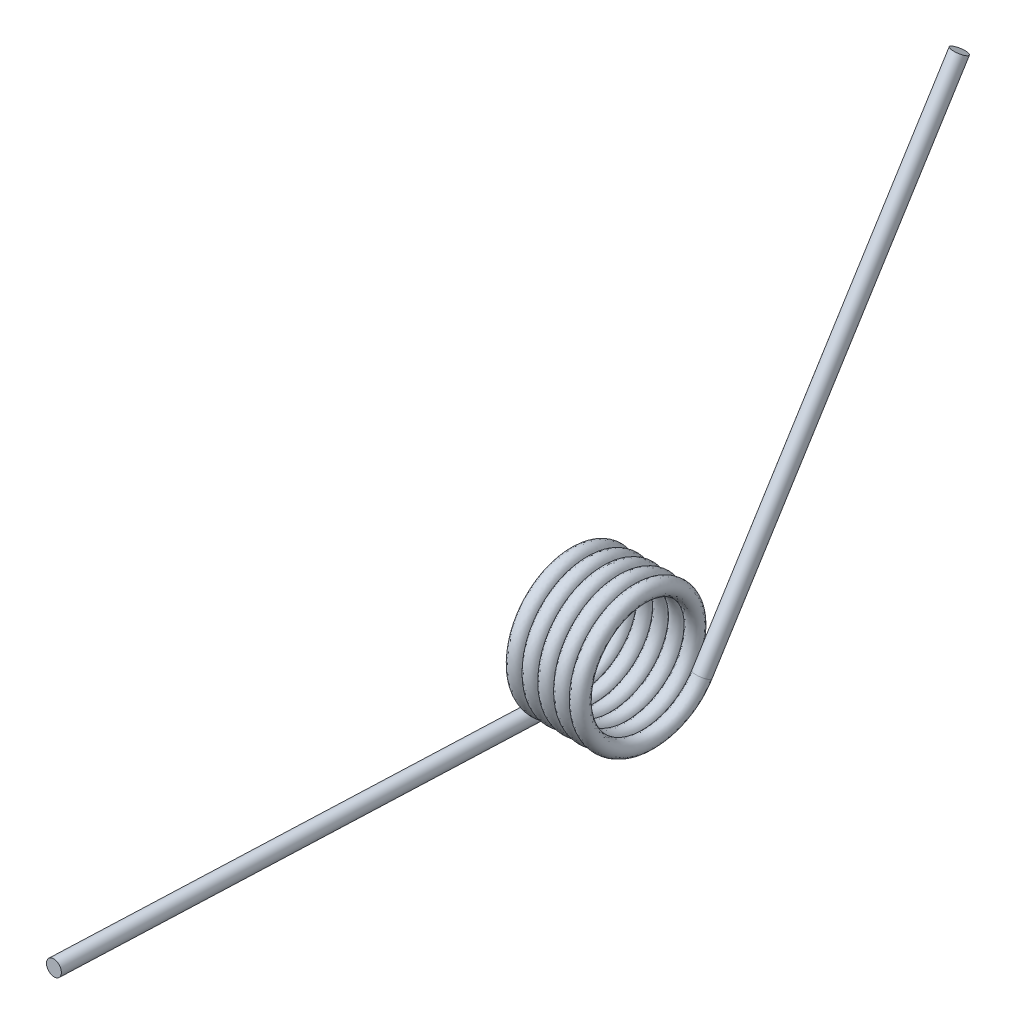
from build123d import *

# Parameters (mm, degrees)
SWEEP1_PITCH   = 1.6256
SKETCH3_R      = 0.8001
EXTRUDE1_DEPTH = 50.8
SKETCH4_R      = 0.8001
EXTRUDE2_DEPTH = 50.8


with BuildPart() as part:
    # Sweep1: the profile of Sketch2 screwed along a right-hand helix of 5.17 turns, 6 arcs to a turn; built about Z, then put on its axis
    sweep1_z = Axis((0, 0, 0), (0, 0, 1))
    sweep1_corners = [(6.240771643, -0.032638523, 0.796263457), (7.108832097, -0.002913077, 0.071068679), (6.383028357, 0.032638523, -0.796263457), (5.514967903, 0.002913077, -0.071068679)]
    with BuildLine(mode=Mode.PRIVATE) as sweep1_profile:
        ThreePointArc((6.240771643, -0.032638523, 0.796263457), (6.825120746, -0.025138777, 0.613296435), (7.108832097, -0.002913077, 0.071068679))
        ThreePointArc((7.108832097, -0.002913077, 0.071068679), (6.925711433, 0.021019065, -0.512790146), (6.383028357, 0.032638523, -0.796263457))
        ThreePointArc((6.383028357, 0.032638523, -0.796263457), (5.798679254, 0.025138777, -0.613296435), (5.514967903, 0.002913077, -0.071068679))
        ThreePointArc((5.514967903, 0.002913077, -0.071068679), (5.698088567, -0.021019065, 0.512790146), (6.240771643, -0.032638523, 0.796263457))
    sweep1_cap = Face(sweep1_profile.wire())
    sweep1_arcs = [((6.240771643, -0.032638523, 0.796263457), (7.03770374, -0.0355516, 0.867332136), (7.108832097, -0.002913077, 0.071068679), (1, 0.7071067811865476, 1)), ((7.108832097, -0.002913077, 0.071068679), (7.179960453, 0.029725446, -0.725194779), (6.383028357, 0.032638523, -0.796263457), (1, 0.7071067811865476, 1)), ((6.383028357, 0.032638523, -0.796263457), (5.58609626, 0.0355516, -0.867332136), (5.514967903, 0.002913077, -0.071068679), (1, 0.7071067811865476, 1)), ((5.514967903, 0.002913077, -0.071068679), (5.443839547, -0.029725446, 0.725194779), (6.240771643, -0.032638523, 0.796263457), (1, 0.7071067811865476, 1))]  # start, shoulder, end, weights
    sweep1_turn_angles = [0, 30, 60, 90, 120, 150, 180, 210, 240, 270, 300, 330, 360]
    sweep1_turn_weights = [1, 0.8660254037844387, 1, 0.8660254037844387, 1, 0.8660254037844387, 1, 0.8660254037844387, 1, 0.8660254037844387, 1, 0.8660254037844387, 1]
    sweep1_turn_sides = [Face.make_bezier_surface([[Vector(p[j][0], p[j][1], 0).rotate(sweep1_z, sweep1_turn_angles[2 * i + k]) / sweep1_turn_weights[2 * i + k] + Vector(0, 0, p[j][2] + SWEEP1_PITCH * sweep1_turn_angles[2 * i + k] / 360) for k in range(3)] for j in range(3)], [[p[3][j] * sweep1_turn_weights[2 * i + k] for k in range(3)] for j in range(3)]) for p in sweep1_arcs for i in range(6)]
    sweep1_last_angles = [1800, 1830, 1860, 1860.600013733, 1861.200027466]
    sweep1_last_weights = [1, 0.8660254037844387, 1, 0.999945166855559, 1]
    sweep1_last_sides = [Face.make_bezier_surface([[Vector(p[j][0], p[j][1], 0).rotate(sweep1_z, sweep1_last_angles[2 * i + k]) / sweep1_last_weights[2 * i + k] + Vector(0, 0, p[j][2] + SWEEP1_PITCH * sweep1_last_angles[2 * i + k] / 360) for k in range(3)] for j in range(3)], [[p[3][j] * sweep1_last_weights[2 * i + k] for k in range(3)] for j in range(3)]) for p in sweep1_arcs for i in range(2)]
    sweep1 = Plane(origin=(0, 0, 0), x_dir=(0, -1, 0), z_dir=(1, 0, 0)) * Solid(Shell([*[p.moved(Location((0, 0, SWEEP1_PITCH * i))) for i in range(5) for p in sweep1_turn_sides], *sweep1_last_sides, sweep1_cap, sweep1_cap.rotate(sweep1_z, 1861.200027466).moved(Location((0, 0, SWEEP1_PITCH * 1861.200027466 / 360)))]))
    add(sweep1)

    # Sketch3 → Extrude1 (add)
    with BuildSketch(Plane(origin=(0, 0, 0), x_dir=(-0.995204921217187, -0.08889933338030673, -0.04079305467392493), z_dir=(-0.04095521208944009, -1.1512926029189078e-14, 0.9991609833268658))):
        with Locations(Location((0.561123702, 6.286908764, 0), (0, 0, 354.899710282))):
            Circle(SKETCH3_R)
    extrude(amount=EXTRUDE1_DEPTH)

    # Sketch4 → Extrude2 (add)
    with BuildSketch(Plane(origin=(0.014096867, 0.301373542, -0.165681319), x_dir=(0.9927938523752088, -0.08996075583046607, -0.07916709604629732), z_dir=(0.04095521208944012, 0.8755716748724814, -0.4813490550148685))):
        with Locations(Location((9.055225843, 5.325187897, 0), (0, 0, 173.528235798))):
            Circle(SKETCH4_R)
    extrude(amount=EXTRUDE2_DEPTH)


solid = part.part
